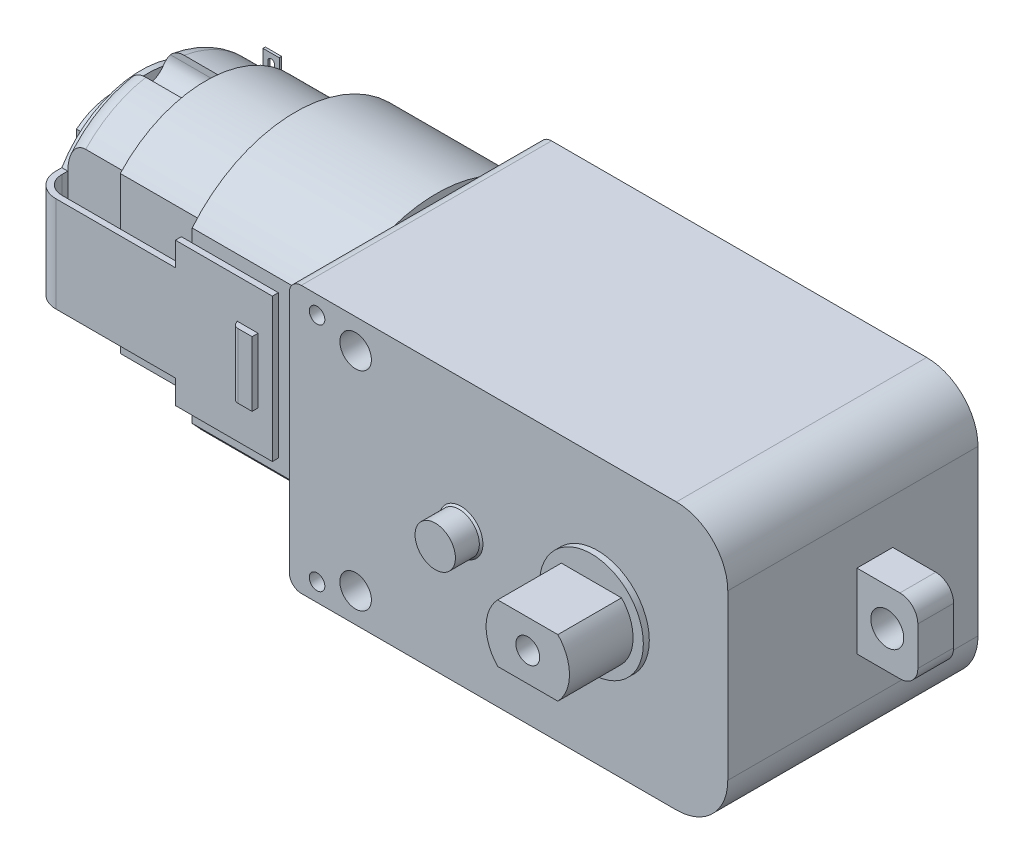
from build123d import *

# Parameters (mm, degrees)
BOSS_EXTRU_1_DEPTH      = 12.32
BOSS_EXTRU_1_DEPTH_BACK = 8.64
ESQUISSE1_R             = 1.32
BOSS_EXTRU_2_DEPTH      = 11.82
BOSS_EXTRU_3_DEPTH      = 7.52
BOSS_EXTRU_4_DEPTH      = 4.9
ESQUISSE5_R             = 4.35
BOSS_EXTRU_5_DEPTH      = 0.5
BOSS_EXTRU_6_DEPTH      = 5.33
BOSS_EXTRU_7_DEPTH      = 1.5
BOSS_EXTRU_7_DEPTH_BACK = 1.5
ESQUISSE7_R             = 1.38
ESQUISSE8_R             = 1.69
BOSS_EXTRU_8_DEPTH      = 2.15
CHANFREIN1_SIZE         = 0.15
ESQUISSE9_R             = 1
ENL_V_MAT_EXTRU_1_DEPTH = 3
ESQUISSE10_W            = 4.25
ESQUISSE10_H            = 1.1
ESQUISSE11_R            = 0.65
ENL_V_MAT_EXTRU_2_DEPTH = 7
ENL_V_START             = -7
ESQUISSE12_R            = 0.65
ENL_V_MAT_EXTRU_4_DEPTH = 7
ENL_V_MAT_EXTRU_5_DEPTH = 4.9
CONG_2_R                = 1.5
ESQUISSE14_W            = 2
ESQUISSE14_H            = 5.4
ENL_V_MAT_EXTRU_6_DEPTH = 1
BOSS_EXTRU_12_DEPTH     = 2.71
BOSS_EXTRU_13_START     = 2.71
ESQUISSE16_R            = 1.1
BOSS_EXTRU_13_DEPTH     = 2.71
ESQUISSE17_W            = 4.4
ESQUISSE17_H            = 6.5
BOSS_EXTRU_14_DEPTH     = 1
CONG_3_R                = 1.5
ESQUISSE18_W            = 1.363420728
ESQUISSE18_H            = 14
BOSS_EXTRU_15_DEPTH     = 0.2
BOSS_EXTRU_16_START     = 0.5
ESQUISSE19_R            = 7.75
BOSS_EXTRU_16_DEPTH     = 0.5
BOSS_EXTRU_17_DEPTH     = 6
ENL_V_MAT_EXTRU_7_REACH = 63.782
ESQUISSE21_W            = 17.800215061
ESQUISSE21_H            = 4.620481356
ESQUISSE22_W            = 3.163046336
ESQUISSE22_H            = 8
BOSS_EXTRU_18_DEPTH     = 0.5
CONG_4_R                = 1.5
CONG_5_R                = 2
CONG_4_OF_SYM_TRIE2_R   = 1.5
CONG_5_OF_SYM_TRIE2_R   = 2


with BuildPart() as part:
    # Esquisse1 → Boss.-Extru.1 (new, two sides: drawn at the far end of the back side and taken through both)
    with BuildSketch(Plane.XY.offset(-BOSS_EXTRU_1_DEPTH_BACK)):
        with BuildLine():
            Line((-24.8, 11.175), (6.62, 11.175))
            ThreePointArc((6.62, 11.175), (9.660559159, 9.915559159), (10.92, 6.875))
            Line((10.92, 6.875), (10.92, -6.875))
            ThreePointArc((10.92, -6.875), (9.660559159, -9.915559159), (6.62, -11.175))
            Line((6.62, -11.175), (-24.8, -11.175))
            ThreePointArc((-24.8, -11.175), (-25.507106781, -10.882106781), (-25.8, -10.175))
            Line((-25.8, -10.175), (-25.8, 10.175))
            ThreePointArc((-25.8, 10.175), (-25.507106781, 10.882106781), (-24.8, 11.175))
        make_face()
        with Locations((-20.25, 8.71)):
            Circle(ESQUISSE1_R, mode=Mode.SUBTRACT)
        with Locations((-20.25, -8.71)):
            Circle(ESQUISSE1_R, mode=Mode.SUBTRACT)
    extrude(amount=BOSS_EXTRU_1_DEPTH + BOSS_EXTRU_1_DEPTH_BACK)

    # Esquisse2 → Boss.-Extru.2 (add)
    with BuildSketch(Plane.ZY.offset(25.8)):
        with BuildLine():
            Line((-8.64, 7.08738492), (-8.64, -7.08738492))
            ThreePointArc((-8.64, -7.08738492), (0, -11.175), (8.64, -7.08738492))
            Line((8.64, -7.08738492), (8.64, 7.08738492))
            ThreePointArc((8.64, 7.08738492), (0, 11.175), (-8.64, 7.08738492))
        make_face()
    extrude(amount=BOSS_EXTRU_2_DEPTH)

    # Esquisse3 → Boss.-Extru.3 (add)
    with BuildSketch(Plane.ZY.offset(37.62)):
        with BuildLine():
            Line((-7.14, 6.528860927), (-7.14, -6.528860927))
            ThreePointArc((-7.14, -6.528860927), (0, -9.675), (7.14, -6.528860927))
            Line((7.14, -6.528860927), (7.14, 6.528860927))
            ThreePointArc((7.14, 6.528860927), (0, 9.675), (-7.14, 6.528860927))
        make_face()
    extrude(amount=BOSS_EXTRU_3_DEPTH)

    # Esquisse4 → Boss.-Extru.4 (add)
    with BuildSketch(Plane.ZY.offset(45.14)):
        with BuildLine():
            Line((6.64, -6.331747389), (6.64, 6.331747389))
            ThreePointArc((6.64, 6.331747389), (0, 9.175), (-6.64, 6.331747389))
            Line((-6.64, 6.331747389), (-6.64, -6.331747389))
            ThreePointArc((-6.64, -6.331747389), (0, -9.175), (6.64, -6.331747389))
        make_face()
    extrude(amount=BOSS_EXTRU_4_DEPTH)

    # Esquisse5 → Boss.-Extru.5 (add)
    with BuildSketch(Plane.XY.offset(12.32)):
        Circle(ESQUISSE5_R)
    extrude(amount=BOSS_EXTRU_5_DEPTH)

    # Esquisse6 → Boss.-Extru.6 (add)
    with BuildSketch(Plane.XY.offset(12.82)):
        with BuildLine():
            Line((-2.519498958, 2.415), (2.519498958, 2.415))
            ThreePointArc((2.519498958, 2.415), (3.49, 0), (2.519498958, -2.415))
            Line((2.519498958, -2.415), (-2.519498958, -2.415))
            ThreePointArc((-2.519498958, -2.415), (-3.49, 0), (-2.519498958, 2.415))
        make_face()
    extrude(amount=BOSS_EXTRU_6_DEPTH)

    # Esquisse7 → Boss.-Extru.7 (add, two sides: drawn at the far end of the back side and taken through both)
    with BuildSketch(Plane.XY.offset(-BOSS_EXTRU_7_DEPTH_BACK)):
        with BuildLine():
            Line((10.92, 3.115), (14.52, 3.115))
            ThreePointArc((14.52, 3.115), (15.580660172, 2.675660172), (16.02, 1.615))
            Line((16.02, 1.615), (16.02, -1.615))
            ThreePointArc((16.02, -1.615), (15.580660172, -2.675660172), (14.52, -3.115))
            Line((14.52, -3.115), (10.92, -3.115))
            Line((10.92, -3.115), (10.92, 3.115))
        make_face()
        with Locations((13.46, 0)):
            Circle(ESQUISSE7_R, mode=Mode.SUBTRACT)
    extrude(amount=BOSS_EXTRU_7_DEPTH + BOSS_EXTRU_7_DEPTH_BACK)

    # Esquisse8 → Boss.-Extru.8 (add)
    with BuildSketch(Plane.XY.offset(12.32)):
        with Locations(Location((-11.43, 0, 0), (0, 0, 180))):
            Circle(ESQUISSE8_R)
    extrude(amount=BOSS_EXTRU_8_DEPTH)

    # Chanfrein1
    chanfrein1_edges = [part.edges().sort_by_distance(p)[0] for p in [
        (-9.74, 0, 12.32),
    ]]
    chamfer(chanfrein1_edges, length=CHANFREIN1_SIZE)

    # Esquisse9 → Enlèv. mat.-Extru.1 (cut)
    with BuildSketch(Plane.XY.offset(18.15)):
        Circle(ESQUISSE9_R)
    extrude(amount=-ENL_V_MAT_EXTRU_1_DEPTH, mode=Mode.SUBTRACT)

    # Esquisse10 → Révolution1 (revolve)
    with BuildSketch(Plane.XY, mode=Mode.PRIVATE) as r_volution1_sk:
        with Locations((-52.165, 0.55)):
            Rectangle(ESQUISSE10_W, ESQUISSE10_H)
    revolve(r_volution1_sk.sketch.rotate(Axis((9.713848328, 0, 0), (-1, 0, 0)), 90), axis=Axis((9.713848328, 0, 0), (-1, 0, 0)))

    # Esquisse11 → Enlèv. mat.-Extru.2 (cut)
    with BuildSketch(Plane.XY.offset(12.32)):
        with Locations((-23.48, 9.67)):
            Circle(ESQUISSE11_R)
        with Locations(Location((-23.48, -9.67, 0), (0, 0, 180))):
            Circle(ESQUISSE11_R)
    extrude(amount=-ENL_V_MAT_EXTRU_2_DEPTH, mode=Mode.SUBTRACT)

    # Esquisse12 → Enlèv. mat.-Extru.4 (cut)
    with BuildSketch(Plane(origin=(0, 0, -8.64), x_dir=(-1, 0, 0), z_dir=(0, 0, -1)).offset(ENL_V_START)):
        with Locations(Location((23.48, 9.67, 0), (0, 0, 180))):
            Circle(ESQUISSE12_R)
        with Locations((23.48, -9.67)):
            Circle(ESQUISSE12_R)
    extrude(amount=ENL_V_MAT_EXTRU_4_DEPTH, mode=Mode.SUBTRACT)

    # Esquisse13 → Enlèv. mat.-Extru.5 (cut)
    with BuildSketch(Plane.ZY.offset(50.04)):
        with BuildLine():
            Line((-1.6, 8.5), (-1.6, 10.836319193))
            Line((-1.6, 10.836319193), (1.6, 10.836319193))
            Line((1.6, 10.836319193), (1.6, 8.5))
            ThreePointArc((1.6, 8.5), (0, 6.9), (-1.6, 8.5))
        make_face()
        with BuildLine():
            Line((1.6, -10.836319193), (1.6, -8.5))
            ThreePointArc((1.6, -8.5), (0, -6.9), (-1.6, -8.5))
            Line((-1.6, -8.5), (-1.6, -10.836319193))
            Line((-1.6, -10.836319193), (1.6, -10.836319193))
        make_face()
    extrude(amount=-ENL_V_MAT_EXTRU_5_DEPTH, mode=Mode.SUBTRACT)

    # Congé2
    cong_2_edges = [part.edges().sort_by_distance(p)[0] for p in [
        (-50.04, -8.085797681, -4.335954434),
        (-50.04, -8.085797681, 4.335954434),
        (-50.04, 8.085797681, 4.335954434),
        (-50.04, 8.085797681, -4.335954434),
    ]]
    fillet(cong_2_edges, radius=CONG_2_R)

    # Esquisse14 → Enlèv. mat.-Extru.6 (cut)
    with BuildSketch(Plane.XY.offset(8.64)):
        with Locations((-31.6, 0)):
            Rectangle(ESQUISSE14_W, ESQUISSE14_H)
    enl_v_mat_extru_6 = extrude(amount=-ENL_V_MAT_EXTRU_6_DEPTH, mode=Mode.SUBTRACT)

    # Esquisse15 → Boss.-Extru.12 (add, symmetric)
    with BuildSketch(Plane(origin=(0, 0, 0), x_dir=(1, 0, 0), z_dir=(0, 1, 0))):
        with BuildLine():
            Line((-33.238196601, -9.363606798), (-33.6, -8.64))
            Line((-33.6, -8.64), (-32.35, -8.64))
            Line((-32.35, -8.64), (-32.35, -9.14))
            Line((-32.35, -9.14), (-31.6, -9.14))
            Line((-31.6, -9.14), (-31.6, -9.64))
            Line((-31.6, -9.64), (-32.790983006, -9.64))
            ThreePointArc((-32.790983006, -9.64), (-33.053848562, -9.565325404), (-33.238196601, -9.363606798))
        make_face()
    boss_extru_12 = extrude(amount=BOSS_EXTRU_12_DEPTH, both=True)

    # Symétrie1: Enlèv. mat.-Extru.6, Boss.-Extru.12 across plane
    add(enl_v_mat_extru_6.mirror(Plane.XY), mode=Mode.SUBTRACT)
    add(boss_extru_12.mirror(Plane.XY))

    # Esquisse16 → Boss.-Extru.13 (add)
    with BuildSketch(Plane.ZY.offset(50.04).offset(BOSS_EXTRU_13_START)):
        with BuildLine():
            Line((3.2, 3.97114593), (3.2, -3.97114593))
            ThreePointArc((3.2, -3.97114593), (-5.1, 0), (3.2, 3.97114593))
        make_face()
        with Locations(Location((0, 0, 0), (0, 0, 180))):
            Circle(ESQUISSE16_R, mode=Mode.SUBTRACT)
    extrude(amount=-BOSS_EXTRU_13_DEPTH)

    # Esquisse17 → Boss.-Extru.14 (add)
    with BuildSketch(Plane(origin=(0, 0, -6.64), x_dir=(-1, 0, 0), z_dir=(0, 0, -1))):
        with Locations((47.84, 0)):
            Rectangle(ESQUISSE17_W, ESQUISSE17_H)
    extrude(amount=BOSS_EXTRU_14_DEPTH)

    # Congé3
    # the kernel refuses this fillet: 1.5 mm, written as the material it takes off along each edge
    with BuildSketch(Plane(origin=(-50.04, 7, -7.64), x_dir=(0, 0, 1), z_dir=(0, -1, 0))) as cong_3_piece_1:
        with BuildLine():
            CenterArc((CONG_3_R, -CONG_3_R), CONG_3_R, 90, 90)
            Line((0, -CONG_3_R), (0, 0))
            Line((0, 0), (CONG_3_R, 0))
        make_face()
    extrude(amount=14, mode=Mode.SUBTRACT)

    # Esquisse18 → Boss.-Extru.15 (add)
    with BuildSketch(Plane(origin=(0, 0, -7.64), x_dir=(-1, 0, 0), z_dir=(0, 0, -1))):
        with Locations((47.085124925, 0)):
            Rectangle(ESQUISSE18_W, ESQUISSE18_H)
        with BuildLine():
            Line((47.366835289, -6.3), (47.366835289, -5.3))
            ThreePointArc((47.366835289, -5.3), (47.083492378, -5.016657089), (46.800149467, -5.3))
            Line((46.800149467, -5.3), (46.800149467, -6.3))
            ThreePointArc((46.800149467, -6.3), (47.083492378, -6.583342911), (47.366835289, -6.3))
        make_face(mode=Mode.SUBTRACT)
        with BuildLine():
            Line((47.366835289, 6.3), (47.366835289, 5.3))
            ThreePointArc((47.366835289, 5.3), (47.083492378, 5.016657089), (46.800149467, 5.3))
            Line((46.800149467, 5.3), (46.800149467, 6.3))
            ThreePointArc((46.800149467, 6.3), (47.083492378, 6.583342911), (47.366835289, 6.3))
        make_face(mode=Mode.SUBTRACT)
    extrude(amount=-BOSS_EXTRU_15_DEPTH)

    # Esquisse19 → Boss.-Extru.16 (add)
    with BuildSketch(Plane.ZY.offset(50.04).offset(BOSS_EXTRU_16_START)):
        Circle(ESQUISSE19_R)
        with BuildLine():
            Line((3.2, -3.97114593), (3.2, 3.97114593))
            ThreePointArc((3.2, 3.97114593), (-5.1, 0), (3.2, -3.97114593))
        make_face(mode=Mode.SUBTRACT)
    extrude(amount=-BOSS_EXTRU_16_DEPTH)

    # Esquisse20 → Boss.-Extru.17 (add, symmetric)
    with BuildSketch(Plane(origin=(0, 0, 0), x_dir=(1, 0, 0), z_dir=(0, 1, 0))):
        Polygon((-32.35, 8.64), (-50.54, 8.64), (-50.54, 9.14), (-30.40378151, 9.14), (-30.40378151, 8.64), align=None)
    boss_extru_17 = extrude(amount=BOSS_EXTRU_17_DEPTH, both=True)

    # Esquisse21 → Enlèv. mat.-Extru.7 (cut, up to next)
    with BuildSketch(Plane(origin=(0, 0, -9.14), x_dir=(-1, 0, 0), z_dir=(0, 0, -1)), mode=Mode.PRIVATE) as enl_v_mat_extru_7_sk1:
        with Locations((47.425980107, -6.310240678)):
            Rectangle(ESQUISSE21_W, ESQUISSE21_H)
    enl_v_mat_extru_7_tool1 = extrude(enl_v_mat_extru_7_sk1.sketch, amount=-ENL_V_MAT_EXTRU_7_REACH, mode=Mode.PRIVATE) & part.part
    # Esquisse21 → Enlèv. mat.-Extru.7 (cut, up to next)
    with BuildSketch(Plane(origin=(0, 0, -9.14), x_dir=(-1, 0, 0), z_dir=(0, 0, -1)), mode=Mode.PRIVATE) as enl_v_mat_extru_7_sk2:
        with Locations((47.425980107, 6.310240678)):
            Rectangle(ESQUISSE21_W, ESQUISSE21_H)
    enl_v_mat_extru_7_tool2 = extrude(enl_v_mat_extru_7_sk2.sketch, amount=-ENL_V_MAT_EXTRU_7_REACH, mode=Mode.PRIVATE) & part.part
    enl_v_mat_extru_7_1 = enl_v_mat_extru_7_tool1.solids().sort_by_distance((-47.42598, -6.310241, -9.14))[0]
    add(enl_v_mat_extru_7_1, mode=Mode.SUBTRACT)
    enl_v_mat_extru_7_2 = enl_v_mat_extru_7_tool2.solids().sort_by_distance((-47.42598, 6.310241, -9.14))[0]
    add(enl_v_mat_extru_7_2, mode=Mode.SUBTRACT)
    enl_v_mat_extru_7 = enl_v_mat_extru_7_1 + enl_v_mat_extru_7_2  # Enlèv. mat.-Extru.7 as one shape, for the pattern or mirror that repeats it

    # Esquisse22 → Boss.-Extru.18 (add)
    with BuildSketch(Plane.ZY.offset(50.54)):
        with Locations((-7.558476832, 0)):
            Rectangle(ESQUISSE22_W, ESQUISSE22_H)
    boss_extru_18 = extrude(amount=-BOSS_EXTRU_18_DEPTH)

    # Congé4
    cong_4_edges = [part.edges().sort_by_distance(p)[0] for p in [
        (-50.04, 0, -8.64),
    ]]
    fillet(cong_4_edges, radius=CONG_4_R)

    # Congé5
    cong_5_edges = [part.edges().sort_by_distance(p)[0] for p in [
        (-50.54, 0, -9.14),
    ]]
    fillet(cong_5_edges, radius=CONG_5_R)

    # Symétrie2: Boss.-Extru.17, Enlèv. mat.-Extru.7, Boss.-Extru.18 across plane
    add(boss_extru_17.mirror(Plane.XY))
    add(enl_v_mat_extru_7.mirror(Plane.XY), mode=Mode.SUBTRACT)
    add(boss_extru_18.mirror(Plane.XY))

    # Congé4 of Symétrie2
    cong_4_of_sym_trie2_edges = [part.edges().sort_by_distance(p)[0] for p in [
        (-50.04, 0, 8.64),
    ]]
    fillet(cong_4_of_sym_trie2_edges, radius=CONG_4_OF_SYM_TRIE2_R)

    # Congé5 of Symétrie2
    cong_5_of_sym_trie2_edges = [part.edges().sort_by_distance(p)[0] for p in [
        (-50.54, 0, 9.14),
    ]]
    fillet(cong_5_of_sym_trie2_edges, radius=CONG_5_OF_SYM_TRIE2_R)


solid = part.part
